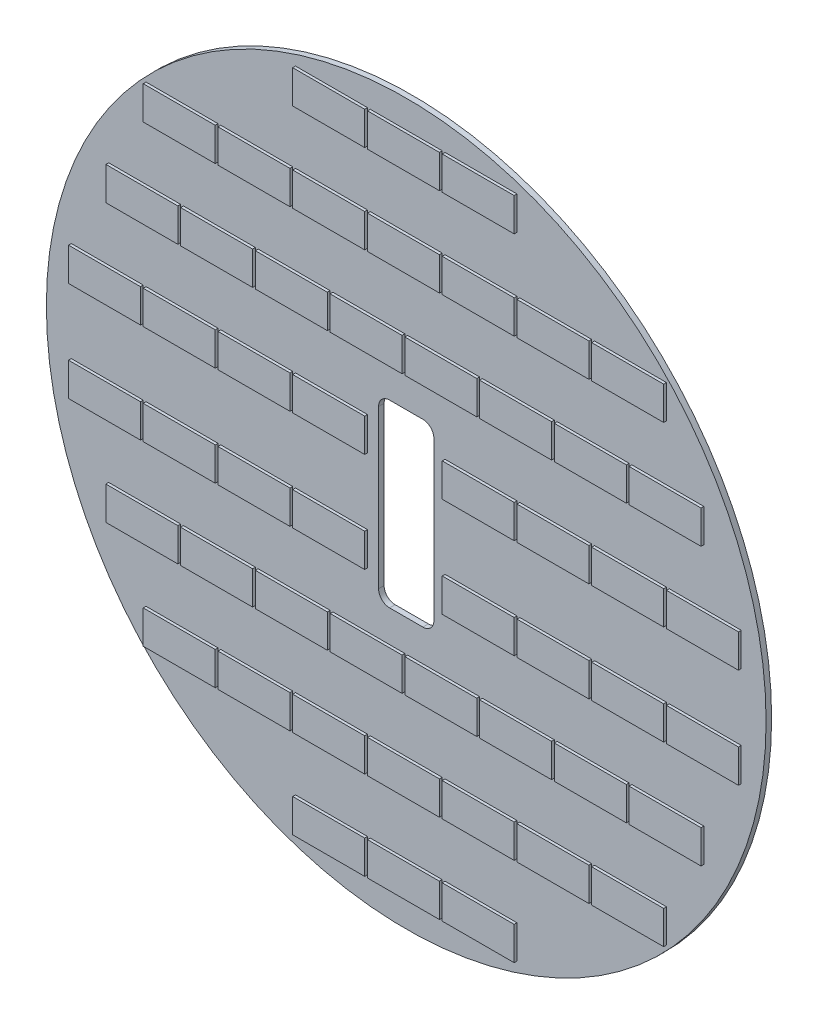
from build123d import *

# Parameters (mm, degrees)
SKETCH_2_R      = 650
SKETCH_2_W      = 100
SKETCH_2_H      = 325
EXTRUDE_1_DEPTH = 10
SKETCH_3_W      = 130
SKETCH_3_H      = 60
EXTRUDE_2_DEPTH = 15
FILLET_2_R      = 20


with BuildPart() as part:
    # 草图2 → 凸台-拉伸1 (new body)
    with BuildSketch(Plane.XY):
        Circle(SKETCH_2_R)
        Rectangle(SKETCH_2_W, SKETCH_2_H, mode=Mode.SUBTRACT)
    extrude(amount=EXTRUDE_1_DEPTH)

    # 草图3 → 凸台-拉伸2 (add)
    with BuildSketch(Plane.XY):
        with Locations((135, 90)):
            Rectangle(SKETCH_3_W, SKETCH_3_H)
        with Locations((270, 90)):
            Rectangle(SKETCH_3_W, SKETCH_3_H)
        with Locations((405, 90)):
            Rectangle(SKETCH_3_W, SKETCH_3_H)
        with Locations((540, 90)):
            Rectangle(SKETCH_3_W, SKETCH_3_H)
        with Locations((202.5, 250)):
            Rectangle(SKETCH_3_W, SKETCH_3_H)
        with Locations((-540, 90)):
            Rectangle(SKETCH_3_W, SKETCH_3_H)
        with Locations((-405, 90)):
            Rectangle(SKETCH_3_W, SKETCH_3_H)
        with Locations((-270, 90)):
            Rectangle(SKETCH_3_W, SKETCH_3_H)
        with Locations((-135, 90)):
            Rectangle(SKETCH_3_W, SKETCH_3_H)
        with Locations((67.5, 250)):
            Rectangle(SKETCH_3_W, SKETCH_3_H)
        with Locations((337.5, 250)):
            Rectangle(SKETCH_3_W, SKETCH_3_H)
        with Locations((472.5, 250)):
            Rectangle(SKETCH_3_W, SKETCH_3_H)
        with Locations((-472.5, 250)):
            Rectangle(SKETCH_3_W, SKETCH_3_H)
        with Locations((-337.5, 250)):
            Rectangle(SKETCH_3_W, SKETCH_3_H)
        with Locations((-202.5, 250)):
            Rectangle(SKETCH_3_W, SKETCH_3_H)
        with Locations((-67.5, 250)):
            Rectangle(SKETCH_3_W, SKETCH_3_H)
        with Locations((135, 410)):
            Rectangle(SKETCH_3_W, SKETCH_3_H)
        with Locations((0, 410)):
            Rectangle(SKETCH_3_W, SKETCH_3_H)
        with Locations((270, 410)):
            Rectangle(SKETCH_3_W, SKETCH_3_H)
        with Locations((405, 410)):
            Rectangle(SKETCH_3_W, SKETCH_3_H)
        with Locations((-405, 410)):
            Rectangle(SKETCH_3_W, SKETCH_3_H)
        with Locations((-270, 410)):
            Rectangle(SKETCH_3_W, SKETCH_3_H)
        with Locations((-135, 410)):
            Rectangle(SKETCH_3_W, SKETCH_3_H)
        with Locations((0, 570)):
            Rectangle(SKETCH_3_W, SKETCH_3_H)
        with Locations((-135, 570)):
            Rectangle(SKETCH_3_W, SKETCH_3_H)
        with Locations((135, 570)):
            Rectangle(SKETCH_3_W, SKETCH_3_H)
        with Locations((135, -570)):
            Rectangle(SKETCH_3_W, SKETCH_3_H)
        with Locations((0, -570)):
            Rectangle(SKETCH_3_W, SKETCH_3_H)
        with Locations((-135, -570)):
            Rectangle(SKETCH_3_W, SKETCH_3_H)
        with Locations((-135, -410)):
            Rectangle(SKETCH_3_W, SKETCH_3_H)
        with Locations((-270, -410)):
            Rectangle(SKETCH_3_W, SKETCH_3_H)
        with Locations((-405, -410)):
            Rectangle(SKETCH_3_W, SKETCH_3_H)
        with Locations((405, -410)):
            Rectangle(SKETCH_3_W, SKETCH_3_H)
        with Locations((270, -410)):
            Rectangle(SKETCH_3_W, SKETCH_3_H)
        with Locations((135, -410)):
            Rectangle(SKETCH_3_W, SKETCH_3_H)
        with Locations((0, -410)):
            Rectangle(SKETCH_3_W, SKETCH_3_H)
        with Locations((-202.5, -250)):
            Rectangle(SKETCH_3_W, SKETCH_3_H)
        with Locations((-67.5, -250)):
            Rectangle(SKETCH_3_W, SKETCH_3_H)
        with Locations((-337.5, -250)):
            Rectangle(SKETCH_3_W, SKETCH_3_H)
        with Locations((-472.5, -250)):
            Rectangle(SKETCH_3_W, SKETCH_3_H)
        with Locations((472.5, -250)):
            Rectangle(SKETCH_3_W, SKETCH_3_H)
        with Locations((337.5, -250)):
            Rectangle(SKETCH_3_W, SKETCH_3_H)
        with Locations((202.5, -250)):
            Rectangle(SKETCH_3_W, SKETCH_3_H)
        with Locations((67.5, -250)):
            Rectangle(SKETCH_3_W, SKETCH_3_H)
        with Locations((-135, -90)):
            Rectangle(SKETCH_3_W, SKETCH_3_H)
        with Locations((-270, -90)):
            Rectangle(SKETCH_3_W, SKETCH_3_H)
        with Locations((-405, -90)):
            Rectangle(SKETCH_3_W, SKETCH_3_H)
        with Locations((-540, -90)):
            Rectangle(SKETCH_3_W, SKETCH_3_H)
        with Locations((540, -90)):
            Rectangle(SKETCH_3_W, SKETCH_3_H)
        with Locations((405, -90)):
            Rectangle(SKETCH_3_W, SKETCH_3_H)
        with Locations((270, -90)):
            Rectangle(SKETCH_3_W, SKETCH_3_H)
        with Locations((135, -90)):
            Rectangle(SKETCH_3_W, SKETCH_3_H)
    extrude(amount=EXTRUDE_2_DEPTH)

    # 圆角2
    fillet_2_edges = [part.edges().sort_by_distance(p)[0] for p in [
        (-50, -162.5, 5),
        (50, -162.5, 5),
        (50, 162.5, 5),
        (-50, 162.5, 5),
    ]]
    fillet(fillet_2_edges, radius=FILLET_2_R)


solid = part.part
